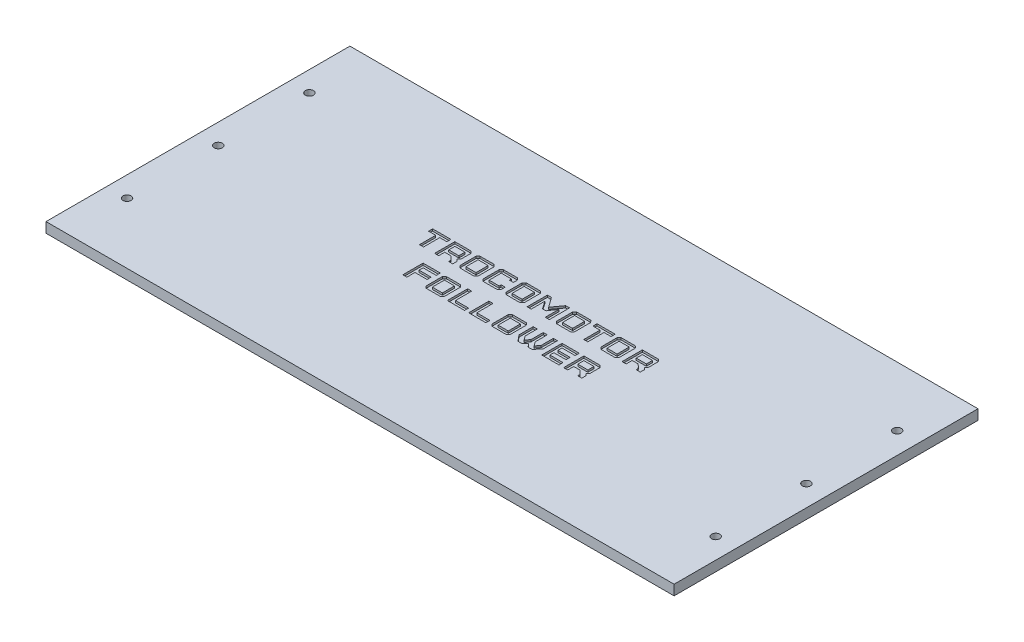
from build123d import *

# Parameters (mm, degrees)
SKETCH1_W           = 310
SKETCH1_H           = 150
BOSS_EXTRUDE1_DEPTH = 5
SKETCH2_W           = 4.98553719
SKETCH2_H           = 3.012396695
SKETCH2_H_2         = 5.995867769
SKETCH2_W_2         = 4.985537191
CUT_EXTRUDE1_DEPTH  = 1
SKETCH3_R           = 2
CUT_EXTRUDE2_DEPTH  = 173.26433177


with BuildPart() as part:
    # Sketch1 → Boss-Extrude1 (new body)
    with BuildSketch(Plane(origin=(0, 0, 0), x_dir=(1, 0, 0), z_dir=(0, 1, 0))):
        Rectangle(SKETCH1_W, SKETCH1_H)
    extrude(amount=BOSS_EXTRUDE1_DEPTH)

    # Sketch2 → Cut-Extrude1 (cut)
    # profile 1 of 18: a face of its own
    with BuildSketch(Plane(origin=(0, 5, 0), x_dir=(1, 0, 0), z_dir=(0, 1, 0))):
        Polygon((-50.972727273, 7.311112148), (-52.966528926, 7.311112148), (-52.966528926, 15.309046033), (-56.468595041, 15.309046033), (-56.468595041, 17.311112148), (-47.499586777, 17.311112148), (-47.499586777, 15.309046033), (-50.972727273, 15.309046033), align=None)
    # profile 2 of 18: a face of its own
    with BuildSketch(Plane(origin=(0, 5, 0), x_dir=(1, 0, 0), z_dir=(0, 1, 0))):
        Polygon((-36.54214876, 7.311112148), (-38.529752066, 7.311112148), (-38.529752066, 8.294583223), (-39.52768595, 9.313178264), (-40.531818182, 10.296649338), (-43.515289256, 10.296649338), (-43.515289256, 7.311112148), (-45.517355372, 7.311112148), (-45.517355372, 17.311112148), (-37.531818182, 17.311112148), (-36.54214876, 16.292517107), (-36.54214876, 11.292517107), (-37.531818182, 10.296649338), (-36.54214876, 9.313178264), align=None)
        with Locations((-41.022520661, 13.802847686)):
            Rectangle(SKETCH2_W, SKETCH2_H, mode=Mode.SUBTRACT)
    # profile 3 of 18: a face of its own
    with BuildSketch(Plane(origin=(0, 5, 0), x_dir=(1, 0, 0), z_dir=(0, 1, 0))):
        Polygon((-26.080578512, 7.311112148), (-33.074380165, 7.311112148), (-34.066115702, 8.294583223), (-34.066115702, 16.292517107), (-33.074380165, 17.311112148), (-26.080578512, 17.311112148), (-25.090909091, 16.292517107), (-25.090909091, 8.294583223), align=None)
        with Locations((-29.571280992, 12.311112149)):
            Rectangle(SKETCH2_W, SKETCH2_H_2, mode=Mode.SUBTRACT)
    # profile 4 of 18: a face of its own
    with BuildSketch(Plane(origin=(0, 5, 0), x_dir=(1, 0, 0), z_dir=(0, 1, 0))):
        Polygon((-14.629338843, 7.311112148), (-21.623140496, 7.311112148), (-22.614876033, 8.294583223), (-22.614876033, 16.292517107), (-21.623140496, 17.311112148), (-14.629338843, 17.311112148), (-13.639669421, 16.292517107), (-13.639669421, 14.313178264), (-15.627272727, 14.313178264), (-15.627272727, 15.309046033), (-20.612809917, 15.309046033), (-20.612809917, 9.313178264), (-15.627272727, 9.313178264), (-15.627272727, 10.296649338), (-13.639669421, 10.296649338), (-13.639669421, 8.294583223), align=None)
    # profile 5 of 18: a face of its own
    with BuildSketch(Plane(origin=(0, 5, 0), x_dir=(1, 0, 0), z_dir=(0, 1, 0))):
        Polygon((-3.310330579, 7.311112148), (-10.304132231, 7.311112148), (-11.295867769, 8.294583223), (-11.295867769, 16.292517107), (-10.304132231, 17.311112148), (-3.310330579, 17.311112148), (-2.320661157, 16.292517107), (-2.320661157, 8.294583223), align=None)
        with Locations((-6.801033058, 12.311112149)):
            Rectangle(SKETCH2_W, SKETCH2_H_2, mode=Mode.SUBTRACT)
    # profile 6 of 18: a face of its own
    with BuildSketch(Plane(origin=(0, 5, 0), x_dir=(1, 0, 0), z_dir=(0, 1, 0))):
        Polygon((2.157438017, 7.311112148), (0.155371901, 7.311112148), (0.155371901, 17.311112148), (2.157438017, 17.311112148), (5.642975207, 12.46400471), (9.186363636, 17.311112148), (11.109917355, 17.311112148), (11.109917355, 7.311112148), (9.109917355, 7.311112148), (9.109917355, 14.054913801), (6.502479339, 10.211938594), (4.82892562, 10.211938594), (2.157438017, 14.054913801), align=None)
    # profile 7 of 18: a face of its own
    with BuildSketch(Plane(origin=(0, 5, 0), x_dir=(1, 0, 0), z_dir=(0, 1, 0))):
        Polygon((21.575619835, 7.311112148), (14.581818182, 7.311112148), (13.590082645, 8.294583223), (13.590082645, 16.292517107), (14.581818182, 17.311112148), (21.575619835, 17.311112148), (22.565289256, 16.292517107), (22.565289256, 8.294583223), align=None)
        with Locations((18.084917355, 12.311112149)):
            Rectangle(SKETCH2_W, SKETCH2_H_2, mode=Mode.SUBTRACT)
    # profile 8 of 18: a face of its own
    with BuildSketch(Plane(origin=(0, 5, 0), x_dir=(1, 0, 0), z_dir=(0, 1, 0))):
        Polygon((30.111570248, 7.311112148), (28.117768595, 7.311112148), (28.117768595, 15.309046033), (24.615702479, 15.309046033), (24.615702479, 17.311112148), (33.584710744, 17.311112148), (33.584710744, 15.309046033), (30.111570248, 15.309046033), align=None)
    # profile 9 of 18: a face of its own
    with BuildSketch(Plane(origin=(0, 5, 0), x_dir=(1, 0, 0), z_dir=(0, 1, 0))):
        Polygon((43.552479339, 7.311112148), (36.558677686, 7.311112148), (35.566942149, 8.294583223), (35.566942149, 16.292517107), (36.558677686, 17.311112148), (43.552479339, 17.311112148), (44.54214876, 16.292517107), (44.54214876, 8.294583223), align=None)
        with Locations((40.06177686, 12.311112149)):
            Rectangle(SKETCH2_W_2, SKETCH2_H_2, mode=Mode.SUBTRACT)
    # profile 10 of 18: a face of its own
    with BuildSketch(Plane(origin=(0, 5, 0), x_dir=(1, 0, 0), z_dir=(0, 1, 0))):
        Polygon((55.99338843, 7.311112148), (54.005785124, 7.311112148), (54.005785124, 8.294583223), (53.00785124, 9.313178264), (52.003719008, 10.296649338), (49.020247934, 10.296649338), (49.020247934, 7.311112148), (47.018181818, 7.311112148), (47.018181818, 17.311112148), (55.003719008, 17.311112148), (55.99338843, 16.292517107), (55.99338843, 11.292517107), (55.003719008, 10.296649338), (55.99338843, 9.313178264), align=None)
        with Locations((51.513016529, 13.802847686)):
            Rectangle(SKETCH2_W, SKETCH2_H, mode=Mode.SUBTRACT)
    # profile 11 of 18: a face of its own
    with BuildSketch(Plane(origin=(0, 5, 0), x_dir=(1, 0, 0), z_dir=(0, 1, 0))):
        Polygon((-42.192975207, -9.688887852), (-44.195041322, -9.688887852), (-44.195041322, 0.311112148), (-35.707438017, 0.311112148), (-35.707438017, -1.690953967), (-42.192975207, -1.690953967), (-42.192975207, -3.705416777), (-36.209504132, -3.705416777), (-36.209504132, -5.707482893), (-42.192975207, -5.707482893), align=None)
    # profile 12 of 18: a face of its own
    with BuildSketch(Plane(origin=(0, 5, 0), x_dir=(1, 0, 0), z_dir=(0, 1, 0))):
        Polygon((-25.683884298, -9.688887852), (-32.67768595, -9.688887852), (-33.669421488, -8.705416777), (-33.669421488, -0.707482893), (-32.67768595, 0.311112148), (-25.683884298, 0.311112148), (-24.694214876, -0.707482893), (-24.694214876, -8.705416777), align=None)
        with Locations((-29.174586777, -4.688887852)):
            Rectangle(SKETCH2_W, SKETCH2_H_2, mode=Mode.SUBTRACT)
    # profile 13 of 18: a face of its own
    with BuildSketch(Plane(origin=(0, 5, 0), x_dir=(1, 0, 0), z_dir=(0, 1, 0))):
        Polygon((-22.218181818, 0.311112148), (-20.216115702, 0.311112148), (-20.216115702, -7.686821736), (-13.730578512, -7.686821736), (-13.730578512, -9.688887852), (-22.218181818, -9.688887852), align=None)
    # profile 14 of 18: a face of its own
    with BuildSketch(Plane(origin=(0, 5, 0), x_dir=(1, 0, 0), z_dir=(0, 1, 0))):
        Polygon((-11.692561983, 0.311112148), (-9.690495868, 0.311112148), (-9.690495868, -7.686821736), (-3.204958678, -7.686821736), (-3.204958678, -9.688887852), (-11.692561983, -9.688887852), align=None)
    # profile 15 of 18: a face of its own
    with BuildSketch(Plane(origin=(0, 5, 0), x_dir=(1, 0, 0), z_dir=(0, 1, 0))):
        Polygon((6.818595041, -9.688887852), (-0.175206612, -9.688887852), (-1.166942149, -8.705416777), (-1.166942149, -0.707482893), (-0.175206612, 0.311112148), (6.818595041, 0.311112148), (7.808264463, -0.707482893), (7.808264463, -8.705416777), align=None)
        with Locations((3.327892562, -4.688887852)):
            Rectangle(SKETCH2_W, SKETCH2_H_2, mode=Mode.SUBTRACT)
    # profile 16 of 18: a face of its own
    with BuildSketch(Plane(origin=(0, 5, 0), x_dir=(1, 0, 0), z_dir=(0, 1, 0))):
        Polygon((17.641735537, -9.688887852), (16.129338843, -7.903763885), (14.643801653, -9.688887852), (12.641735537, -9.688887852), (10.145867769, -6.703350662), (10.145867769, 0.311112148), (12.145867769, 0.311112148), (12.145867769, -5.707482893), (13.660330579, -7.686821736), (15.131404959, -5.707482893), (15.131404959, 0.311112148), (17.125206612, 0.311112148), (17.125206612, -5.707482893), (18.639669421, -7.686821736), (20.123140496, -5.707482893), (20.123140496, 0.311112148), (22.110743802, 0.311112148), (22.110743802, -6.703350662), (19.643801653, -9.688887852), align=None)
    # profile 17 of 18: a face of its own
    with BuildSketch(Plane(origin=(0, 5, 0), x_dir=(1, 0, 0), z_dir=(0, 1, 0))):
        Polygon((32.867768595, -9.688887852), (24.380165289, -9.688887852), (24.380165289, 0.311112148), (32.867768595, 0.311112148), (32.867768595, -1.690953967), (26.382231405, -1.690953967), (26.382231405, -3.705416777), (32.365702479, -3.705416777), (32.365702479, -5.707482893), (26.382231405, -5.707482893), (26.382231405, -7.686821736), (32.867768595, -7.686821736), align=None)
    # profile 18 of 18: a face of its own
    with BuildSketch(Plane(origin=(0, 5, 0), x_dir=(1, 0, 0), z_dir=(0, 1, 0))):
        Polygon((44.145454545, -9.688887852), (42.15785124, -9.688887852), (42.15785124, -8.705416777), (41.159917355, -7.686821736), (40.155785124, -6.703350662), (37.17231405, -6.703350662), (37.17231405, -9.688887852), (35.170247934, -9.688887852), (35.170247934, 0.311112148), (43.155785124, 0.311112148), (44.145454545, -0.707482893), (44.145454545, -5.707482893), (43.155785124, -6.703350662), (44.145454545, -7.686821736), align=None)
        with Locations((39.665082645, -3.197152315)):
            Rectangle(SKETCH2_W, SKETCH2_H, mode=Mode.SUBTRACT)
    extrude(amount=-CUT_EXTRUDE1_DEPTH, mode=Mode.SUBTRACT)

    # Sketch3 → Cut-Extrude2 (cut, through all)
    with BuildSketch(Plane(origin=(0, 5, 0), x_dir=(1, 0, 0), z_dir=(0, 1, 0))):
        with Locations((-145, 45)):
            Circle(SKETCH3_R)
        with Locations((-145, 0)):
            Circle(SKETCH3_R)
        with Locations((-145, -45)):
            Circle(SKETCH3_R)
        with Locations((144.858844931, -44.325661451)):
            Circle(SKETCH3_R)
        with Locations((144.64946667, 0.673851443)):
            Circle(SKETCH3_R)
        with Locations((144.440088408, 45.673364338)):
            Circle(SKETCH3_R)
    extrude(amount=-CUT_EXTRUDE2_DEPTH, mode=Mode.SUBTRACT)


solid = part.part
